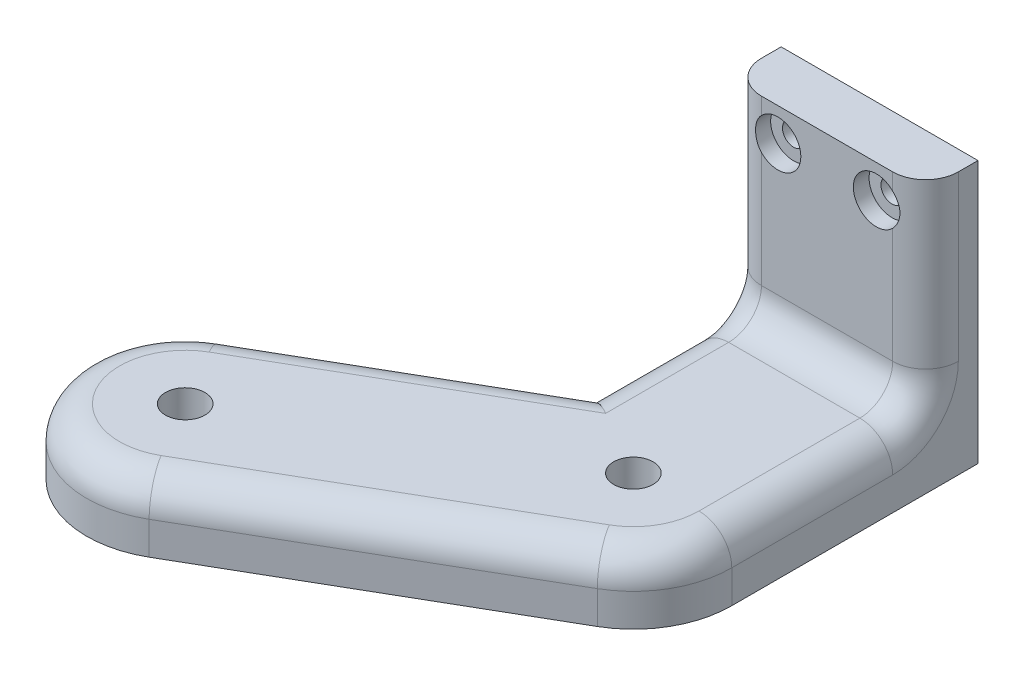
from build123d import *

# Parameters (mm, degrees)
CROQUIS1_R                                           = 3
SALIENTE_EXTRUIR1_DEPTH                              = 5
CROQUIS2_W                                           = 30
CROQUIS2_H                                           = 30
SALIENTE_EXTRUIR2_DEPTH                              = 8
REFRENTADO_PARA_TORNILLO_CON_CABEZA_TRON_D           = 3.4
REFRENTADO_PARA_TORNILLO_CON_CABEZA_TRON_CBORE_D     = 7
REFRENTADO_PARA_TORNILLO_CON_CABEZA_TRON_CBORE_DEPTH = 2.4
CROQUIS11_R                                          = 6.5
CORTAR_EXTRUIR3_DEPTH                                = 5
REDONDEO8_R                                          = 5


with BuildPart() as part:
    # Croquis1 → Saliente-Extruir1 (new, symmetric)
    with BuildSketch(Plane(origin=(0, 0, 0), x_dir=(-1, 0, 0), z_dir=(0, 1, 0))):
        with BuildLine():
            Line((15, 0), (-15, 0))
            Line((-15, 0), (-15, 37.5217))
            ThreePointArc((-15, 37.5217), (-12.990381057, 45.0217), (-7.5, 50.512081057))
            Line((-7.5, 50.512081057), (35.801270189, 75.512081057))
            ThreePointArc((35.801270189, 75.512081057), (56.291651246, 70.0217), (50.801270189, 49.531318943))
            Line((50.801270189, 49.531318943), (15, 28.861445962))
            Line((15, 28.861445962), (15, 0))
        make_face()
        with Locations(Location((0, 37.5217, 0), (0, 0, 90))):
            Circle(CROQUIS1_R, mode=Mode.SUBTRACT)
        with Locations(Location((43.301270189, 62.5217, 0), (0, 0, 90))):
            Circle(CROQUIS1_R, mode=Mode.SUBTRACT)
    extrude(amount=SALIENTE_EXTRUIR1_DEPTH, both=True)

    # Croquis2 → Saliente-Extruir2 (add)
    with BuildSketch(Plane(origin=(0, 0, 0), x_dir=(1, 0, 0), z_dir=(0, 0, -1))):
        with Locations((0, -20)):
            Rectangle(CROQUIS2_W, CROQUIS2_H)
    extrude(amount=-SALIENTE_EXTRUIR2_DEPTH)

    # Refrentado para tornillo con cabeza troncocónica de M31 (through all)
    with Locations(Plane.XY.offset(8)):
        with Locations((-7.5, 30), (7.5, 30)):
            CounterBoreHole(REFRENTADO_PARA_TORNILLO_CON_CABEZA_TRON_D / 2, REFRENTADO_PARA_TORNILLO_CON_CABEZA_TRON_CBORE_D / 2, REFRENTADO_PARA_TORNILLO_CON_CABEZA_TRON_CBORE_DEPTH)

    # Croquis11 → Cortar-Extruir3 (cut)
    with BuildSketch(Plane.XZ.offset(5)):
        with Locations(Location((0, 37.5217, 0), (0, 0, 270))):
            Circle(CROQUIS11_R)
    extrude(amount=-CORTAR_EXTRUIR3_DEPTH, mode=Mode.SUBTRACT)

    # Redondeo8
    # the kernel refuses this fillet: 5 mm, written as the material it adds along each edge
    with BuildSketch(Plane(origin=(15, 5, 8), x_dir=(0, 0, 1), z_dir=(-1, 0, 0))) as redondeo8_piece_1:
        with BuildLine():
            CenterArc((REDONDEO8_R, REDONDEO8_R), REDONDEO8_R, 180, 90)
            Line((0, REDONDEO8_R), (0, 0))
            Line((0, 0), (REDONDEO8_R, 0))
        make_face()
    extrude(amount=30)
    # the kernel refuses this fillet: 5 mm, written as the material it takes off along each edge
    with BuildSketch(Plane(origin=(-50.801270189, 5, 49.531318943), x_dir=(0.4999999999999951, 0, 0.8660254037844415), z_dir=(0.8660254037844415, 0, -0.49999999999999517))) as redondeo8_2_piece_1_section:
        with BuildLine():
            CenterArc((REDONDEO8_R, REDONDEO8_R), REDONDEO8_R, 180, 90)
            Line((0, REDONDEO8_R), (0, 0))
            Line((0, 0), (REDONDEO8_R, 0))
        make_face()
    redondeo8_2_piece_1 = extrude(amount=53.839745962, mode=Mode.PRIVATE)
    redondeo8_2_piece_1 = split(redondeo8_2_piece_1, bisect_by=Plane(origin=(-15, 3.85828394, 40.323429829), z_dir=(-1, 0, 0)), keep=Keep.TOP, mode=Mode.PRIVATE)
    add(redondeo8_2_piece_1, mode=Mode.SUBTRACT)
    with BuildSketch(Plane(origin=(-43.301270189, 5, 62.5217), x_dir=(0.4999999999999953, 0, 0.8660254037844414), z_dir=(0.8660254037844414, 0, -0.4999999999999953))) as redondeo8_2_piece_2:
        with BuildLine():
            CenterArc((15 - REDONDEO8_R, REDONDEO8_R), REDONDEO8_R, 270, 90)
            Line((15, REDONDEO8_R), (15, 0))
            Line((15, 0), (15 - REDONDEO8_R, 0))
        make_face()
    revolve(axis=Axis((-43.301270189, 5, 62.5217), (0, -1, 0)), revolution_arc=180, mode=Mode.SUBTRACT)
    with BuildSketch(Plane(origin=(7.5, 5, 50.512081057), x_dir=(0, -1, 0), z_dir=(-0.8660254037844416, 0, 0.499999999999995))) as redondeo8_2_piece_3:
        with BuildLine():
            CenterArc((REDONDEO8_R, -REDONDEO8_R), REDONDEO8_R, 90, 90)
            Line((0, -REDONDEO8_R), (0, 0))
            Line((0, 0), (REDONDEO8_R, 0))
        make_face()
    extrude(amount=50, mode=Mode.SUBTRACT)
    with BuildSketch(Plane(origin=(0, 5, 37.5217), x_dir=(1, 0, 0), z_dir=(0, 0, -1))) as redondeo8_2_piece_4:
        with BuildLine():
            CenterArc((15 - REDONDEO8_R, REDONDEO8_R), REDONDEO8_R, 270, 90)
            Line((15 - REDONDEO8_R, 0), (15, 0))
            Line((15, 0), (15, REDONDEO8_R))
        make_face()
    revolve(axis=Axis((0, 5, 37.5217), (0, -1, 0)), revolution_arc=60, mode=Mode.SUBTRACT)
    with BuildSketch(Plane(origin=(-15, 5, 41.361445962), x_dir=(1, 0, 0), z_dir=(0, 0, -1))) as redondeo8_2_piece_5_section:
        with BuildLine():
            CenterArc((REDONDEO8_R, REDONDEO8_R), REDONDEO8_R, 180, 90)
            Line((0, REDONDEO8_R), (0, 0))
            Line((0, 0), (REDONDEO8_R, 0))
        make_face()
    redondeo8_2_piece_5 = extrude(amount=28.361445962, mode=Mode.PRIVATE)
    redondeo8_2_piece_5 = split(redondeo8_2_piece_5, bisect_by=Plane(origin=(-10.61401453, 3.841965375, 26.329196071), z_dir=(-0.49999999999999517, 0, -0.8660254037844415)), keep=Keep.TOP, mode=Mode.PRIVATE)
    add(redondeo8_2_piece_5, mode=Mode.SUBTRACT)
    with BuildSketch(Plane(origin=(15, 47.5, 8), x_dir=(0, 0, -1), z_dir=(0, -1, 0))) as redondeo8_2_piece_6:
        with BuildLine():
            CenterArc((REDONDEO8_R, -REDONDEO8_R), REDONDEO8_R, 90, 90)
            Line((0, -REDONDEO8_R), (0, 0))
            Line((0, 0), (REDONDEO8_R, 0))
        make_face()
    extrude(amount=37.5, mode=Mode.SUBTRACT)
    with BuildSketch(Plane(origin=(-15, 10, 8), x_dir=(1, 0, 0), z_dir=(0, 1, 0))) as redondeo8_2_piece_7:
        with BuildLine():
            CenterArc((REDONDEO8_R, REDONDEO8_R), REDONDEO8_R, 180, 90)
            Line((0, REDONDEO8_R), (0, 0))
            Line((0, 0), (REDONDEO8_R, 0))
        make_face()
    extrude(amount=37.5, mode=Mode.SUBTRACT)
    with BuildSketch(Plane(origin=(15, 5, 13), x_dir=(0, -1, 0), z_dir=(0, 0, 1))) as redondeo8_2_piece_8:
        with BuildLine():
            CenterArc((REDONDEO8_R, -REDONDEO8_R), REDONDEO8_R, 90, 90)
            Line((0, -REDONDEO8_R), (0, 0))
            Line((0, 0), (REDONDEO8_R, 0))
        make_face()
    extrude(amount=24.5217, mode=Mode.SUBTRACT)
    with BuildSketch(Plane(origin=(15, 10, 13), x_dir=(0, -1, 0), z_dir=(0, 0, 1))) as redondeo8_2_piece_9:
        with BuildLine():
            CenterArc((5 + REDONDEO8_R, -REDONDEO8_R), REDONDEO8_R, 90, 90)
            Line((5, -REDONDEO8_R), (5, 0))
            Line((5, 0), (5 + REDONDEO8_R, 0))
        make_face()
    revolve(axis=Axis((15, 10, 13), (1, 0, 0)), revolution_arc=90, mode=Mode.SUBTRACT)
    with BuildSketch(Plane(origin=(-15, 10, 13), x_dir=(0, -1, 0), z_dir=(0, 0, 1))) as redondeo8_2_piece_10:
        with BuildLine():
            CenterArc((5 + REDONDEO8_R, REDONDEO8_R), REDONDEO8_R, 180, 90)
            Line((5, REDONDEO8_R), (5, 0))
            Line((5, 0), (5 + REDONDEO8_R, 0))
        make_face()
    revolve(axis=Axis((-15, 10, 13), (1, 0, 0)), revolution_arc=90, mode=Mode.SUBTRACT)
    with BuildSketch(Plane(origin=(-15, 5, 41.361445962), x_dir=(1, 0, 0), z_dir=(0, 0, -1))) as redondeo8_2_piece_11a_section:
        with BuildLine():
            CenterArc((REDONDEO8_R, REDONDEO8_R), REDONDEO8_R, 180, 90)
            Line((0, REDONDEO8_R), (0, 0))
            Line((0, 0), (REDONDEO8_R, 0))
        make_face()
    redondeo8_2_piece_11a = extrude(amount=28.361445962, mode=Mode.PRIVATE)
    redondeo8_2_piece_11a = split(redondeo8_2_piece_11a, bisect_by=Plane(origin=(-16.671225656, 3.89815345, 29.826328544), z_dir=(0.49999999999999517, 0, 0.8660254037844415)), keep=Keep.TOP, mode=Mode.PRIVATE)
    with BuildSketch(Plane(origin=(-50.801270189, 5, 49.531318943), x_dir=(0.4999999999999951, 0, 0.8660254037844415), z_dir=(0.8660254037844415, 0, -0.49999999999999517))) as redondeo8_2_piece_11b_section:
        with BuildLine():
            CenterArc((REDONDEO8_R, REDONDEO8_R), REDONDEO8_R, 180, 90)
            Line((0, REDONDEO8_R), (0, 0))
            Line((0, 0), (REDONDEO8_R, 0))
        make_face()
    redondeo8_2_piece_11b = extrude(amount=53.839745962, mode=Mode.PRIVATE)
    redondeo8_2_piece_11b = split(redondeo8_2_piece_11b, bisect_by=Plane(origin=(-15, 3.89815345, 26.931680798), z_dir=(1, 0, 0)), keep=Keep.TOP, mode=Mode.PRIVATE)
    redondeo8_2_piece_11 = redondeo8_2_piece_11a & redondeo8_2_piece_11b
    add(redondeo8_2_piece_11, mode=Mode.SUBTRACT)


solid = part.part
